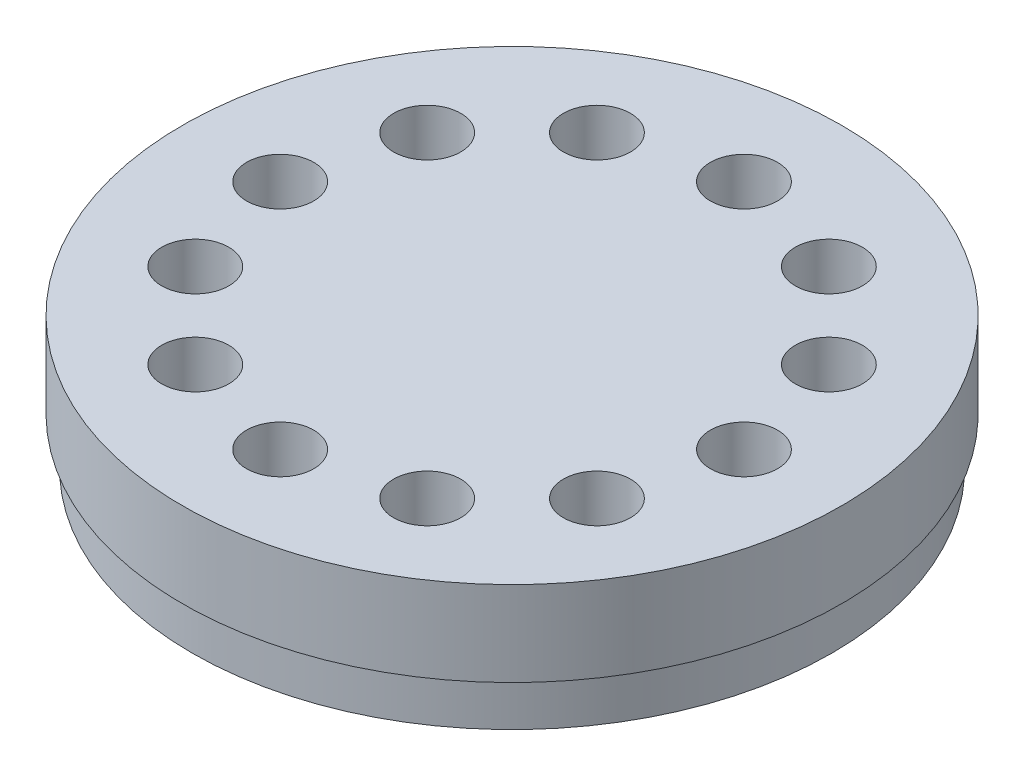
from build123d import *

# Parameters (mm, degrees)
CIRPATTERN1_COUNT = 12


with BuildPart() as part:
    # Sketch1 → Revolve1 (revolve)
    with BuildSketch(Plane.XY):
        Polygon((0, 0), (-30.6832, 0), (-30.6832, -7.8994), (-29.7942, -7.8994), (-29.7942, -12.319), (-26.1112, -12.319), (-26.1112, -6.223), (0, -6.223), align=None)
    revolve(axis=Axis((0, -6.223, 0), (0, 1, 0)))

    # Sketch3 → D (0.246) Diameter Hole1 (revolve, cut)
    with BuildSketch(Plane(origin=(0, 0, -21.59), x_dir=(0, 0, 1), z_dir=(1, 0, 0))):
        Polygon((0, 0), (0, 14.577208746), (3.1242, 12.7), (3.1242, 0), align=None)
    d_0_246_diameter_hole1 = revolve(axis=Axis((0, 6.35, -21.59), (0, -1, 0)), mode=Mode.SUBTRACT)

    # CirPattern1: D (0.246) Diameter Hole1 ×12 about axis
    cirpattern1_axis = Axis((0, -6.223, 0), (0, -1, 0))
    for i in range(1, CIRPATTERN1_COUNT):
        add(d_0_246_diameter_hole1.rotate(cirpattern1_axis, i * 360 / CIRPATTERN1_COUNT), mode=Mode.SUBTRACT)


solid = part.part
